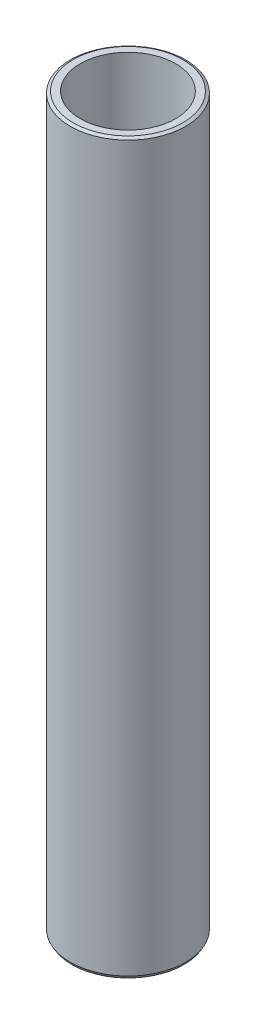
from build123d import *
from OCP.BRepFilletAPI import BRepFilletAPI_MakeChamfer

# Parameters (mm, degrees)
SKETCH1_R           = 47.5
BOSS_EXTRUDE1_DEPTH = 600
SKETCH2_R           = 39.283295878
CUT_EXTRUDE1_DEPTH  = 604.748706003
CHAMFER1_SIZE       = 1.354535713
CHAMFER1_SIZE2      = 2.346124676


with BuildPart() as part:
    # Sketch1 → Boss-Extrude1 (new body)
    with BuildSketch(Plane(origin=(0, 0, 0), x_dir=(1, 0, 0), z_dir=(0, 1, 0))):
        Circle(SKETCH1_R)
    extrude(amount=BOSS_EXTRUDE1_DEPTH)

    # Sketch2 → Cut-Extrude1 (cut, through all)
    with BuildSketch(Plane(origin=(0, 0, 0), x_dir=(1, 0, 0), z_dir=(0, 1, 0))):
        Circle(SKETCH2_R)
    extrude(amount=CUT_EXTRUDE1_DEPTH, mode=Mode.SUBTRACT)

    # Chamfer1: one chamfer whose edges measure the first distance from different faces: ONE call of the kernel's chamfer builder (chamfer() names one face for all edges)
    chamfer1_edges_1 = [part.edges().sort_by_distance(p)[0] for p in [
        (-47.5, 600, 0),
    ]]
    chamfer1_side_1 = [part.faces().sort_by_distance(p)[0] for p in [
        (-47.5, 300, 0),
    ]]
    chamfer1_edges_2 = [part.edges().sort_by_distance(p)[0] for p in [
        (-47.5, 0, 0),
    ]]
    chamfer1_side_2 = [part.faces().sort_by_distance(p)[0] for p in [
        (-46.156497116, 0, 0),
    ]]
    chamfer1 = BRepFilletAPI_MakeChamfer(part.part.solid().wrapped)
    for e in chamfer1_edges_1:
        chamfer1.Add(CHAMFER1_SIZE, CHAMFER1_SIZE2, e.wrapped, chamfer1_side_1[0].wrapped)  # the first distance lies on this face
    for e in chamfer1_edges_2:
        chamfer1.Add(CHAMFER1_SIZE, CHAMFER1_SIZE2, e.wrapped, chamfer1_side_2[0].wrapped)  # the first distance lies on this face
    add(Compound.cast(chamfer1.Shape()), mode=Mode.REPLACE)


solid = part.part
